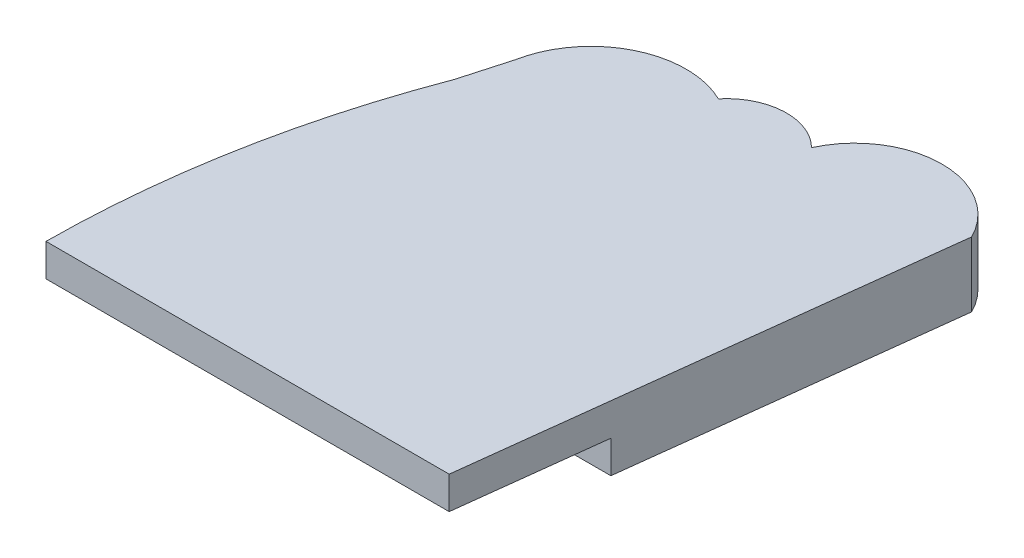
from build123d import *

# Parameters (mm, degrees)
PIED_GAUCHE_SYM_TRIQUE_START = 8.25
PIED_GAUCHE_SYM_TRIQUE_DEPTH = 13.5
ESQUISSE2_W                  = 127.532024566
ESQUISSE2_H                  = 119.503632389
ENL_V_MAT_EXTRU_3_DEPTH      = 302.826111243
ESQUISSE3_W                  = 31.738465923
ESQUISSE3_H                  = 10.347254195
ENL_V_MAT_EXTRU_5_DEPTH      = 207.107541608


# Read off the part's stored shape, not the designer's step: pied_gauche_Symétrique
with BuildPart() as part:
    # pied_gauche_Symétrique outline → pied_gauche_Symétrique (new body)
    with BuildSketch(Plane(origin=(0, 0, 0), x_dir=(1, 0, 0), z_dir=(0, 1, 0)).offset(PIED_GAUCHE_SYM_TRIQUE_START)):
        with BuildLine():
            add(Edge.make_bspline(
                [(37.478644966, -252.078923217), (36.315942048, -246.147042601), (34.178554605, -240.439587675)],
                knots=[0.172395677, 0.172395677, 0.172395677, 1, 1, 1], degree=2))
            ThreePointArc((37.478644966, -252.078923217), (68.296716845, -277.385748803), (95.718365725, -248.433337016))
            ThreePointArc((95.718365725, -248.433337016), (95.727304168, -248.184441724), (95.749998935, -247.936422149))
            Line((95.749998935, -247.936422149), (116.839136919, -71.443633134))
            ThreePointArc((116.839136919, -71.443633134), (100.314842401, -61.417925092), (84.153017918, -72.018045866))
            ThreePointArc((84.153017918, -72.018045866), (74.728050938, -68.392019497), (65.697628344, -72.911924095))
            ThreePointArc((65.697628344, -72.911924095), (48.169524668, -72.986859822), (37.57616681, -86.951844718))
            add(Edge.make_bspline(
                [(37.57616681, -86.951844718), (36.224938138, -91.89952807), (34.78531821, -96.822767534)],
                knots=[0.221662646, 0.221662646, 0.221662646, 1, 1, 1], degree=2))
            ThreePointArc((34.78531821, -96.822767534), (21.501008197, -168.576334761), (34.178554605, -240.439587675))
        make_face()
    extrude(amount=PIED_GAUCHE_SYM_TRIQUE_DEPTH)

    # Esquisse2 → Enlèv. mat.-Extru.3 (cut, through all)
    with BuildSketch(Plane(origin=(0, 0, 0), x_dir=(1, 0, 0), z_dir=(0, 1, 0))):
        with Locations((63.766012283, -228.143835691)):
            Rectangle(ESQUISSE2_W, ESQUISSE2_H)
    extrude(amount=ENL_V_MAT_EXTRU_3_DEPTH, mode=Mode.SUBTRACT)

    # Esquisse3 → Enlèv. mat.-Extru.5 (cut, through all)
    with BuildSketch(Plane(origin=(0, 0, 0), x_dir=(0, 0, -1), z_dir=(1, 0, 0))):
        with Locations((-154.261252458, 9.826372903)):
            Rectangle(ESQUISSE3_W, ESQUISSE3_H)
    extrude(amount=ENL_V_MAT_EXTRU_5_DEPTH, mode=Mode.SUBTRACT)


solid = part.part
